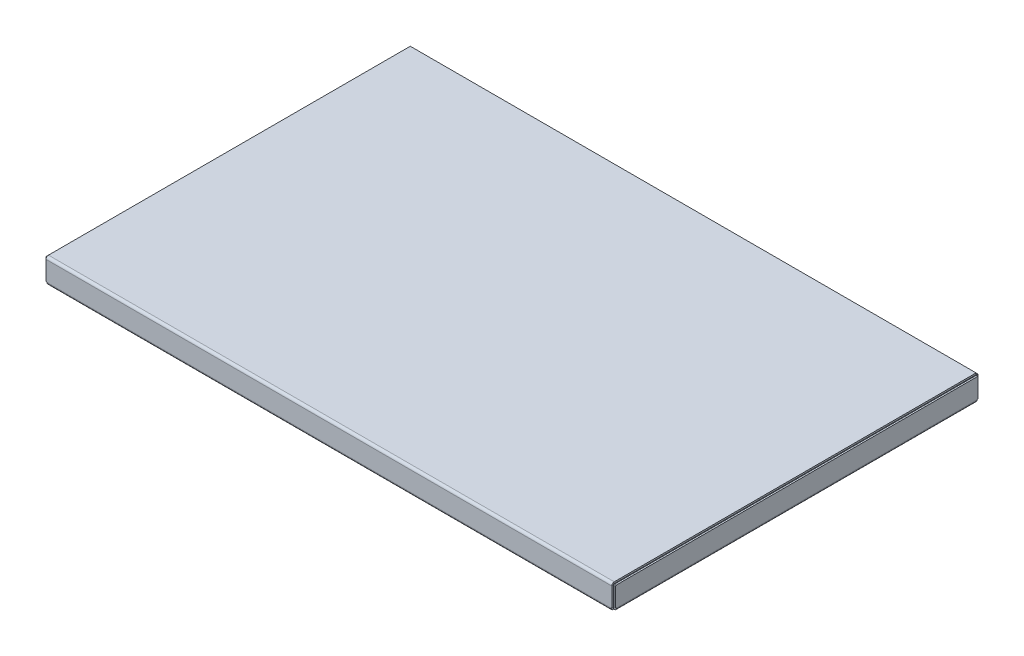
from build123d import *

# Parameters (mm, degrees)
SKETCH2_W                  = 700
SKETCH2_H                  = 450
BOSS_EXTRUDE1_DEPTH        = 30
CONVERT_SOLID1_START       = 3
CONVERT_SOLID1_DEPTH       = 694
CONVERT_SOLID1_2_OUTLINE_W = 24.146446609
CONVERT_SOLID1_2_OUTLINE_H = 2
CONVERT_SOLID1_2_DEPTH     = 2.353553391
CONVERT_SOLID1_START_2     = 697.646446609
CONVERT_SOLID1_3_OUTLINE_W = 24.146446609
CONVERT_SOLID1_3_OUTLINE_H = 2
CONVERT_SOLID1_3_DEPTH     = 2.353553391
CONVERT_SOLID1_4_DEPTH     = 700
CONVERT_SOLID1_5_DEPTH     = 2.353553391
CONVERT_SOLID1_6_DEPTH     = 2.353553391
CONVERT_SOLID1_START_3     = 2.353553391
CONVERT_SOLID1_7_DEPTH     = 1.146446609
CONVERT_SOLID1_START_4     = 696.5
CONVERT_SOLID1_8_DEPTH     = 1.146446609
CONVERT_SOLID1_START_5     = -447.646446609
CONVERT_SOLID1_9_DEPTH     = 445.292893218


with BuildPart() as part:
    # Sketch2 → Boss-Extrude1 (new body)
    with BuildSketch(Plane(origin=(0, 0, 0), x_dir=(1, 0, 0), z_dir=(0, 1, 0))):
        with Locations((350, 225)):
            Rectangle(SKETCH2_W, SKETCH2_H)
    extrude(amount=BOSS_EXTRUDE1_DEPTH)

    # Convert-Solid1: read off the stored shape, not the designer's step
    # Convert-Solid1 outline → Convert-Solid1 (cut)
    with BuildSketch(Plane.YZ.offset(CONVERT_SOLID1_START)):
        with BuildLine():
            Line((3.5, -3.5), (2, -3.5))
            Line((2, -3.5), (2, -446.5))
            Line((2, -446.5), (3.5, -446.5))
            Line((3.5, -446.5), (3.5, -447.646446609))
            Line((3.5, -447.646446609), (27.646446609, -447.646446609))
            Line((27.646446609, -447.646446609), (27.646446609, -3.353553391))
            ThreePointArc((27.646446609, -3.353553391), (27.353553391, -2.646446609), (26.646446609, -2.353553391))
            Line((26.646446609, -2.353553391), (3.5, -2.353553391))
            Line((3.5, -2.353553391), (3.5, -3.5))
        make_face()
    extrude(amount=CONVERT_SOLID1_DEPTH, mode=Mode.SUBTRACT)

    # Convert-Solid1 2 outline → Convert-Solid1 2 (cut)
    with BuildSketch(Plane.YZ):
        with Locations((15.573223305, -449)):
            Rectangle(CONVERT_SOLID1_2_OUTLINE_W, CONVERT_SOLID1_2_OUTLINE_H)
    extrude(amount=CONVERT_SOLID1_2_DEPTH, mode=Mode.SUBTRACT)

    # Convert-Solid1 3 outline → Convert-Solid1 3 (cut)
    with BuildSketch(Plane.YZ.offset(CONVERT_SOLID1_START_2)):
        with Locations((15.573223305, -449)):
            Rectangle(CONVERT_SOLID1_3_OUTLINE_W, CONVERT_SOLID1_3_OUTLINE_H)
    extrude(amount=CONVERT_SOLID1_3_DEPTH, mode=Mode.SUBTRACT)

    # Convert-Solid1 4 outline → Convert-Solid1 4 (cut)
    with BuildSketch(Plane.YZ):
        with BuildLine():
            Line((2, -3), (2, -3.5))
            Line((2, -3.5), (3.5, -3.5))
            Line((3.5, -3.5), (3.5, -2.353553391))
            Line((3.5, -2.353553391), (26.646446609, -2.353553391))
            ThreePointArc((26.646446609, -2.353553391), (27.353553391, -2.646446609), (27.646446609, -3.353553391))
            Line((27.646446609, -3.353553391), (27.646446609, -447.646446609))
            Line((27.646446609, -447.646446609), (3.5, -447.646446609))
            Line((3.5, -447.646446609), (3.5, -446.5))
            Line((3.5, -446.5), (2, -446.5))
            Line((2, -446.5), (2, -447))
            ThreePointArc((2, -447), (2.292893219, -447.707106781), (3, -448))
            Line((3, -448), (27.646446609, -448))
            Line((27.646446609, -448), (27.646446609, -450))
            Line((27.646446609, -450), (30, -450))
            Line((30, -450), (30, -447.646446609))
            Line((30, -447.646446609), (28, -447.646446609))
            Line((28, -447.646446609), (28, -3))
            ThreePointArc((28, -3), (27.707106781, -2.292893219), (27, -2))
            Line((27, -2), (3, -2))
            ThreePointArc((3, -2), (2.292893219, -2.292893219), (2, -3))
        make_face()
        with BuildLine():
            Line((0, 0), (0, -3))
            ThreePointArc((0, -3), (0.878679656, -0.878679656), (3, 0))
            Line((3, 0), (0, 0))
        make_face()
        with BuildLine():
            ThreePointArc((3, -450), (0.878679656, -449.121320344), (0, -447))
            Line((0, -447), (0, -450))
            Line((0, -450), (3, -450))
        make_face()
        with BuildLine():
            Line((30, 0), (27, 0))
            ThreePointArc((27, 0), (29.121320344, -0.878679656), (30, -3))
            Line((30, -3), (30, 0))
        make_face()
    extrude(amount=CONVERT_SOLID1_4_DEPTH, mode=Mode.SUBTRACT)

    # Convert-Solid1 5 outline → Convert-Solid1 5 (cut)
    with BuildSketch(Plane.YZ):
        with BuildLine():
            Line((0, -3), (0, -3.5))
            Line((0, -3.5), (2, -3.5))
            Line((2, -3.5), (2, -3))
            ThreePointArc((2, -3), (2.292893219, -2.292893219), (3, -2))
            Line((3, -2), (27, -2))
            ThreePointArc((27, -2), (27.707106781, -2.292893219), (28, -3))
            Line((28, -3), (28, -447.646446609))
            Line((28, -447.646446609), (30, -447.646446609))
            Line((30, -447.646446609), (30, -3))
            ThreePointArc((30, -3), (29.121320344, -0.878679656), (27, 0))
            Line((27, 0), (3, 0))
            ThreePointArc((3, 0), (0.878679656, -0.878679656), (0, -3))
        make_face()
        with BuildLine():
            Line((2, -446.5), (0, -446.5))
            Line((0, -446.5), (0, -447))
            ThreePointArc((0, -447), (0.878679656, -449.121320344), (3, -450))
            Line((3, -450), (3.5, -450))
            Line((3.5, -450), (3.5, -448))
            Line((3.5, -448), (3, -448))
            ThreePointArc((3, -448), (2.292893219, -447.707106781), (2, -447))
            Line((2, -447), (2, -446.5))
        make_face()
    extrude(amount=CONVERT_SOLID1_5_DEPTH, mode=Mode.SUBTRACT)

    # Convert-Solid1 6 outline → Convert-Solid1 6 (cut)
    with BuildSketch(Plane.YZ.offset(CONVERT_SOLID1_START_2)):
        with BuildLine():
            Line((0, -3), (0, -3.5))
            Line((0, -3.5), (2, -3.5))
            Line((2, -3.5), (2, -3))
            ThreePointArc((2, -3), (2.292893219, -2.292893219), (3, -2))
            Line((3, -2), (27, -2))
            ThreePointArc((27, -2), (27.707106781, -2.292893219), (28, -3))
            Line((28, -3), (28, -447.646446609))
            Line((28, -447.646446609), (30, -447.646446609))
            Line((30, -447.646446609), (30, -3))
            ThreePointArc((30, -3), (29.121320344, -0.878679656), (27, 0))
            Line((27, 0), (3, 0))
            ThreePointArc((3, 0), (0.878679656, -0.878679656), (0, -3))
        make_face()
        with BuildLine():
            Line((2, -446.5), (0, -446.5))
            Line((0, -446.5), (0, -447))
            ThreePointArc((0, -447), (0.878679656, -449.121320344), (3, -450))
            Line((3, -450), (3.5, -450))
            Line((3.5, -450), (3.5, -448))
            Line((3.5, -448), (3, -448))
            ThreePointArc((3, -448), (2.292893219, -447.707106781), (2, -447))
            Line((2, -447), (2, -446.5))
        make_face()
    extrude(amount=CONVERT_SOLID1_6_DEPTH, mode=Mode.SUBTRACT)

    # Convert-Solid1 7 outline → Convert-Solid1 7 (cut)
    with BuildSketch(Plane.YZ.offset(CONVERT_SOLID1_START_3)):
        with BuildLine():
            Line((0, -3), (0, -3.5))
            Line((0, -3.5), (2, -3.5))
            Line((2, -3.5), (2, -3))
            ThreePointArc((2, -3), (2.292893219, -2.292893219), (3, -2))
            Line((3, -2), (3.5, -2))
            Line((3.5, -2), (3.5, 0))
            Line((3.5, 0), (3, 0))
            ThreePointArc((3, 0), (0.878679656, -0.878679656), (0, -3))
        make_face()
        with BuildLine():
            Line((2, -446.5), (0, -446.5))
            Line((0, -446.5), (0, -447))
            ThreePointArc((0, -447), (0.878679656, -449.121320344), (3, -450))
            Line((3, -450), (3.5, -450))
            Line((3.5, -450), (3.5, -448))
            Line((3.5, -448), (3, -448))
            ThreePointArc((3, -448), (2.292893219, -447.707106781), (2, -447))
            Line((2, -447), (2, -446.5))
        make_face()
    extrude(amount=CONVERT_SOLID1_7_DEPTH, mode=Mode.SUBTRACT)

    # Convert-Solid1 8 outline → Convert-Solid1 8 (cut)
    with BuildSketch(Plane.YZ.offset(CONVERT_SOLID1_START_4)):
        with BuildLine():
            Line((0, -3), (0, -3.5))
            Line((0, -3.5), (2, -3.5))
            Line((2, -3.5), (2, -3))
            ThreePointArc((2, -3), (2.292893219, -2.292893219), (3, -2))
            Line((3, -2), (3.5, -2))
            Line((3.5, -2), (3.5, 0))
            Line((3.5, 0), (3, 0))
            ThreePointArc((3, 0), (0.878679656, -0.878679656), (0, -3))
        make_face()
        with BuildLine():
            Line((2, -446.5), (0, -446.5))
            Line((0, -446.5), (0, -447))
            ThreePointArc((0, -447), (0.878679656, -449.121320344), (3, -450))
            Line((3, -450), (3.5, -450))
            Line((3.5, -450), (3.5, -448))
            Line((3.5, -448), (3, -448))
            ThreePointArc((3, -448), (2.292893219, -447.707106781), (2, -447))
            Line((2, -447), (2, -446.5))
        make_face()
    extrude(amount=CONVERT_SOLID1_8_DEPTH, mode=Mode.SUBTRACT)

    # Convert-Solid1 9 outline → Convert-Solid1 9 (cut)
    with BuildSketch(Plane.XY.offset(CONVERT_SOLID1_START_5)):
        with BuildLine():
            Line((0, 0), (3, 0))
            ThreePointArc((3, 0), (0.878679656, 0.878679656), (0, 3))
            Line((0, 3), (0, 0))
        make_face()
        with BuildLine():
            ThreePointArc((700, 3), (699.121320344, 0.878679656), (697, 0))
            Line((697, 0), (700, 0))
            Line((700, 0), (700, 3))
        make_face()
        with BuildLine():
            Line((697, 27.646446609), (697, 2))
            ThreePointArc((697, 2), (697.707106781, 2.292893219), (698, 3))
            Line((698, 3), (698, 27.646446609))
            Line((698, 27.646446609), (697, 27.646446609))
        make_face()
        with BuildLine():
            Line((3, 2), (3, 27.646446609))
            Line((3, 27.646446609), (2, 27.646446609))
            Line((2, 27.646446609), (2, 3))
            ThreePointArc((2, 3), (2.292893219, 2.292893219), (3, 2))
        make_face()
    extrude(amount=CONVERT_SOLID1_9_DEPTH, mode=Mode.SUBTRACT)


solid = part.part
